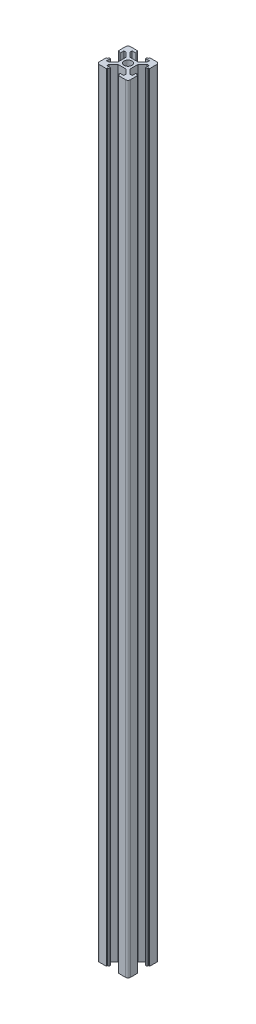
from build123d import *

# Parameters (mm, degrees)
BOSS_EXTRUDE1_DEPTH = 500


with BuildPart() as part:
    # Sketch1 → Boss-Extrude1 (new body)
    with BuildSketch(Plane(origin=(0, 0, 0), x_dir=(1, 0, 0), z_dir=(0, 1, 0))):
        with BuildLine():
            Line((8.5, 10), (3.9, 10))
            Line((3.9, 10), (3.9, 9.2))
            Line((3.9, 9.2), (3.1, 9.2))
            Line((3.1, 9.2), (3.1, 8.2))
            Line((3.1, 8.2), (5.5, 8.2))
            Line((5.5, 8.2), (5.5, 6.77))
            Line((5.5, 6.77), (2.63, 3.9))
            Line((2.63, 3.9), (2.549104946, 3.9))
            Line((2.549104946, 3.9), (0, 3.9))
            Line((0, 3.9), (-2.63, 3.9))
            Line((-2.63, 3.9), (-5.5, 6.77))
            Line((-5.5, 6.77), (-5.5, 8.2))
            Line((-5.5, 8.2), (-3.1, 8.2))
            Line((-3.1, 8.2), (-3.1, 9.2))
            Line((-3.1, 9.2), (-3.9, 9.2))
            Line((-3.9, 9.2), (-3.9, 10))
            Line((-3.9, 10), (-8.5, 10))
            ThreePointArc((-8.5, 10), (-9.560660172, 9.560660172), (-10, 8.5))
            Line((-10, 8.5), (-10, 3.9))
            Line((-10, 3.9), (-9.2, 3.9))
            Line((-9.2, 3.9), (-9.2, 3.1))
            Line((-9.2, 3.1), (-8.2, 3.1))
            Line((-8.2, 3.1), (-8.2, 5.5))
            Line((-8.2, 5.5), (-6.77, 5.5))
            Line((-6.77, 5.5), (-3.9, 2.63))
            Line((-3.9, 2.63), (-3.9, 0))
            Line((-3.9, 0), (-3.9, -2.63))
            Line((-3.9, -2.63), (-6.77, -5.5))
            Line((-6.77, -5.5), (-8.2, -5.5))
            Line((-8.2, -5.5), (-8.2, -3.1))
            Line((-8.2, -3.1), (-9.2, -3.1))
            Line((-9.2, -3.1), (-9.2, -3.9))
            Line((-9.2, -3.9), (-10, -3.9))
            Line((-10, -3.9), (-10, -8.5))
            ThreePointArc((-10, -8.5), (-9.560660172, -9.560660172), (-8.5, -10))
            Line((-8.5, -10), (-3.9, -10))
            Line((-3.9, -10), (-3.9, -9.2))
            Line((-3.9, -9.2), (-3.1, -9.2))
            Line((-3.1, -9.2), (-3.1, -8.2))
            Line((-3.1, -8.2), (-5.5, -8.2))
            Line((-5.5, -8.2), (-5.5, -6.77))
            Line((-5.5, -6.77), (-2.63, -3.9))
            Line((-2.63, -3.9), (0, -3.9))
            Line((0, -3.9), (2.63, -3.9))
            Line((2.63, -3.9), (5.5, -6.77))
            Line((5.5, -6.77), (5.5, -8.2))
            Line((5.5, -8.2), (3.1, -8.2))
            Line((3.1, -8.2), (3.1, -9.2))
            Line((3.1, -9.2), (3.9, -9.2))
            Line((3.9, -9.2), (3.9, -10))
            Line((3.9, -10), (8.5, -10))
            ThreePointArc((8.5, -10), (9.560660172, -9.560660172), (10, -8.5))
            Line((10, -8.5), (10, -3.9))
            Line((10, -3.9), (9.2, -3.9))
            Line((9.2, -3.9), (9.2, -3.1))
            Line((9.2, -3.1), (8.2, -3.1))
            Line((8.2, -3.1), (8.2, -5.5))
            Line((8.2, -5.5), (6.77, -5.5))
            Line((6.77, -5.5), (3.9, -2.63))
            Line((3.9, -2.63), (3.9, 0))
            Line((3.9, 0), (3.9, 2.63))
            Line((3.9, 2.63), (6.77, 5.5))
            Line((6.77, 5.5), (8.2, 5.5))
            Line((8.2, 5.5), (8.2, 3.1))
            Line((8.2, 3.1), (9.2, 3.1))
            Line((9.2, 3.1), (9.2, 3.9))
            Line((9.2, 3.9), (10, 3.9))
            Line((10, 3.9), (10, 8.5))
            ThreePointArc((10, 8.5), (9.560660172, 9.560660172), (8.5, 10))
        make_face()
        with BuildLine():
            ThreePointArc((0, 2.5), (1.767766953, 1.767766953), (2.5, 0))
            ThreePointArc((2.5, 0), (-1.767766953, -1.767766953), (0, 2.5))
        make_face(mode=Mode.SUBTRACT)
    extrude(amount=BOSS_EXTRUDE1_DEPTH)


solid = part.part
